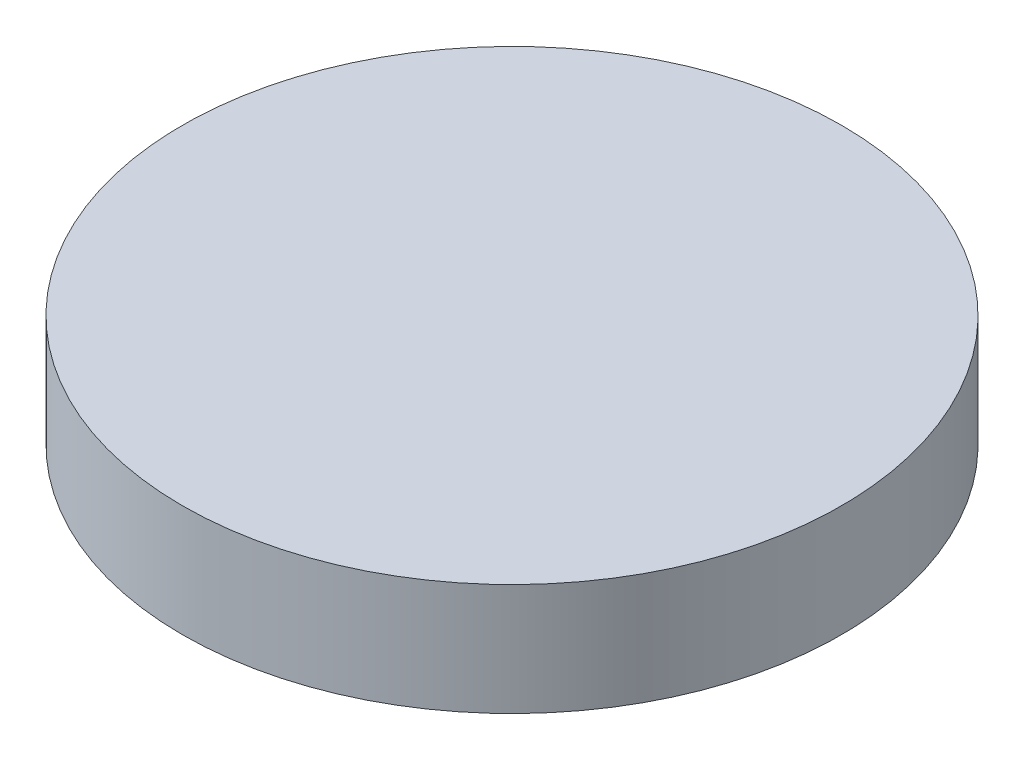
from build123d import *

# Parameters (mm, degrees)
SKETCH1_R                      = 37.465
BOSS_EXTRUDE1_DEPTH            = 12.7
M3_CLEARANCE_HOLE1_D           = 3.4
M3_CLEARANCE_HOLE1_DEPTH       = 9.652
M3_CLEARANCE_HOLE1_CSINK_D     = 3.45
M3_CLEARANCE_HOLE1_CSINK_ANGLE = 90
M3_CLEARANCE_HOLE1_TIP         = 1.021463052
THREAD1_PITCH                  = 0.5


with BuildPart() as part:
    # Sketch1 → Boss-Extrude1 (new body)
    with BuildSketch(Plane(origin=(0, 0, 0), x_dir=(1, 0, 0), z_dir=(0, 1, 0))):
        with Locations(Location((0, 0, 0), (0, 0, 270))):
            Circle(SKETCH1_R)
    extrude(amount=BOSS_EXTRUDE1_DEPTH)

    # M3 Clearance Hole1
    with Locations(Plane(origin=(0, 0, 0), x_dir=(-1, 0, 0), z_dir=(0, -1, 0))):
        with Locations((0, 0)):
            CounterSinkHole(M3_CLEARANCE_HOLE1_D / 2, M3_CLEARANCE_HOLE1_CSINK_D / 2, depth=M3_CLEARANCE_HOLE1_DEPTH, counter_sink_angle=M3_CLEARANCE_HOLE1_CSINK_ANGLE)
            with Locations((0, 0, -(M3_CLEARANCE_HOLE1_DEPTH + M3_CLEARANCE_HOLE1_TIP / 2))):  # 118° drill point
                Cone(0, M3_CLEARANCE_HOLE1_D / 2, M3_CLEARANCE_HOLE1_TIP, mode=Mode.SUBTRACT)

    # Thread1: the profile of Thread Profile1 profile screwed along a right-hand helix of 20 turns, 6 arcs to a turn; built about Z, then put on its axis
    thread1_z = Axis((0, 0, 0), (0, 0, 1))
    thread1_corners = [(1.7003, 0, -0.000173205), (1.7003, 0, 0.437673204), (1.429367062, 0, 0.281249999), (1.429367062, 0, 0.156249999)]
    with BuildLine(mode=Mode.PRIVATE) as thread1_profile:
        Line(thread1_corners[0], thread1_corners[1])
        Line(thread1_corners[1], thread1_corners[2])
        Line(thread1_corners[2], thread1_corners[3])
        Line(thread1_corners[3], thread1_corners[0])
    thread1_cap = Face(thread1_profile.wire())
    thread1_turn_angles = [0, 30, 60, 90, 120, 150, 180, 210, 240, 270, 300, 330, 360]
    thread1_turn_weights = [1, 0.8660254037844387, 1, 0.8660254037844387, 1, 0.8660254037844387, 1, 0.8660254037844387, 1, 0.8660254037844387, 1, 0.8660254037844387, 1]
    thread1_turn_rails = [Edge.make_bspline([Vector(p[0], p[1], 0).rotate(thread1_z, thread1_turn_angles[k]) / thread1_turn_weights[k] + Vector(0, 0, p[2] + THREAD1_PITCH * thread1_turn_angles[k] / 360) for k in range(13)], [0, 0, 0, 1, 1, 2, 2, 3, 3, 4, 4, 5, 5, 6, 6, 6], 2, thread1_turn_weights) for p in thread1_corners]
    thread1_turn_sides = [Face.make_surface_from_curves(thread1_turn_rails[p[0]], thread1_turn_rails[p[1]]) for p in [(0, 1), (1, 2), (2, 3), (3, 0)]]
    thread1 = Plane(origin=(0, 0.025, 0), x_dir=(1, 0, 0), z_dir=(0, 1, 0)) * Solid(Shell([*[p.moved(Location((0, 0, THREAD1_PITCH * i))) for i in range(20) for p in thread1_turn_sides], thread1_cap, thread1_cap.rotate(thread1_z, 7200).moved(Location((0, 0, THREAD1_PITCH * 7200 / 360)))]))
    add(thread1)


solid = part.part
